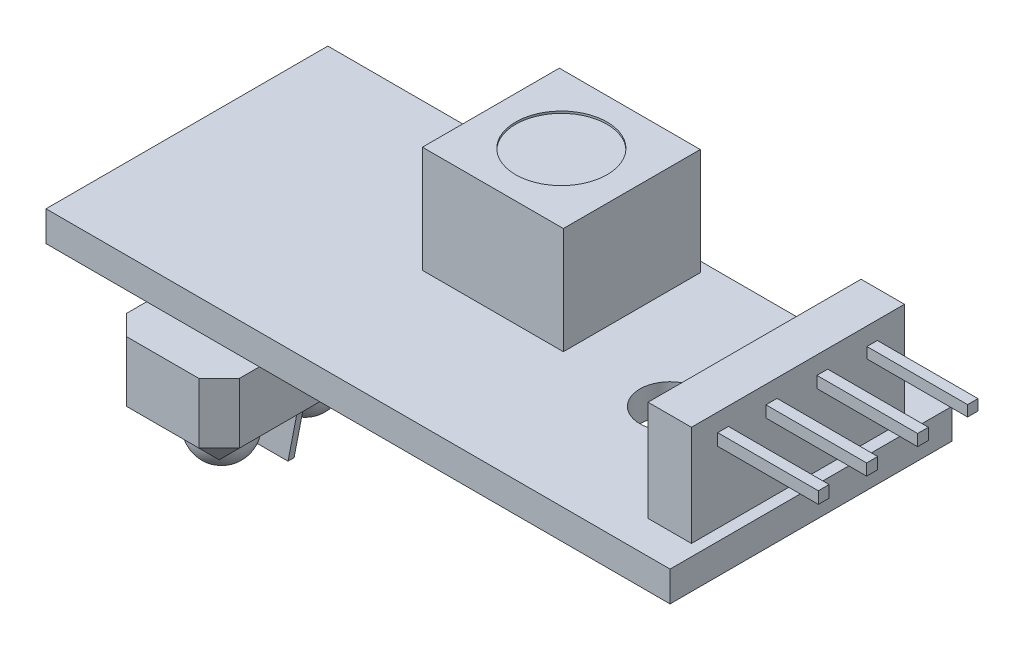
from build123d import *
from OCP.BRepFilletAPI import BRepFilletAPI_MakeChamfer

# Parameters (mm, degrees)
SKETCH_1_W          = 31
SKETCH_1_H          = 14
EXTRUDE_1_DEPTH     = 1.5
SKETCH_2_W          = 7
SKETCH_2_H          = 6.8
EXTRUDE_2_DEPTH     = 5.3
SKETCH_3_W          = 2.154803144
SKETCH_3_H          = 10.581622582
EXTRUDE_3_DEPTH     = 5
SKETCH_5_W          = 0.534399799
SKETCH_5_H          = 0.586115909
EXTRUDE_4_DEPTH     = 5
SKETCH_5_W_2        = 0.551638502
SKETCH_5_H_2        = 0.568877205
EXTRUDE_4_2_DEPTH   = 5
EXTRUDE_4_3_DEPTH   = 5
SKETCH_5_W_3        = 0.517161096
SKETCH_5_H_3        = 0.534399799
EXTRUDE_4_4_DEPTH   = 5
EXTRUDE_START       = 4
SKETCH_6_W          = 5.6
SKETCH_6_H          = 10
EXTRUDE_5_DEPTH     = 4
EXTRUDE_6_REACH     = 38.99
SKETCH_7_W          = 0.6
SKETCH_7_H          = 0.6
CHAMFER_1_SIZE      = 1
SKETCH_8_R          = 1.5
CUT_EXTRUDE_1_DEPTH = 3
SKETCH_9_W          = 3.6
SKETCH_9_H          = 0.3
EXTRUDE_7_DEPTH     = 2.2
CHAMFER_2_SIZE      = 2.2
CHAMFER_2_SIZE_2    = 0.42763668
SKETCH_12_R         = 2.270300466
CUT_EXTRUDE_2_DEPTH = 0.1


with BuildPart() as part:
    # 草圖1 → 填料-伸長1 (new body)
    with BuildSketch(Plane(origin=(0, 0, 0), x_dir=(1, 0, 0), z_dir=(0, 1, 0))):
        with Locations((15.5, 0)):
            Rectangle(SKETCH_1_W, SKETCH_1_H)
    extrude(amount=EXTRUDE_1_DEPTH)

    # 草圖8 → 除料-伸長1 (cut)
    with BuildSketch(Plane(origin=(0, 1.5, 0), x_dir=(1, 0, 0), z_dir=(0, 1, 0))):
        with Locations(Location((24, 0, 0), (0, 0, 270))):
            Circle(SKETCH_8_R)
    extrude(amount=-CUT_EXTRUDE_1_DEPTH, mode=Mode.SUBTRACT)


with BuildPart() as body_2:
    # 草圖2 → 填料-伸長2 (new body)
    with BuildSketch(Plane(origin=(0, 1.5, 0), x_dir=(1, 0, 0), z_dir=(0, 1, 0))):
        with Locations((15.5, 3.1)):
            Rectangle(SKETCH_2_W, SKETCH_2_H)
    extrude(amount=EXTRUDE_2_DEPTH)

    # 草圖12 → 除料-伸長2 (cut)
    with BuildSketch(Plane(origin=(0, 6.8, 0), x_dir=(1, 0, 0), z_dir=(0, 1, 0))):
        with Locations(Location((15.5, 3.1, 0), (0, 0, 270))):
            Circle(SKETCH_12_R)
    extrude(amount=-CUT_EXTRUDE_2_DEPTH, mode=Mode.SUBTRACT)


with BuildPart() as body_3:
    # 草圖3 → 填料-伸長3 (new body)
    with BuildSketch(Plane(origin=(0, 1.5, 0), x_dir=(1, 0, 0), z_dir=(0, 1, 0))):
        with Locations((29.352305926, -0.076957255)):
            Rectangle(SKETCH_3_W, SKETCH_3_H)
    extrude(amount=EXTRUDE_3_DEPTH)


with BuildPart() as body_4:
    # 草圖5 → 填料-伸長4 (new body)
    with BuildSketch(Plane(origin=(30.429707498, 0, 0), x_dir=(0, 0, -1), z_dir=(1, 0, 0))):
        with Locations((-3.795796662, 5.3218671)):
            Rectangle(SKETCH_5_W, SKETCH_5_H)
    extrude(amount=EXTRUDE_4_DEPTH)


with BuildPart() as body_5:
    # 草圖5 → Extrude 4 2 (new body)
    with BuildSketch(Plane(origin=(30.429707498, 0, 0), x_dir=(0, 0, -1), z_dir=(1, 0, 0))):
        with Locations((-1.390997567, 5.330486452)):
            Rectangle(SKETCH_5_W_2, SKETCH_5_H_2)
    extrude(amount=EXTRUDE_4_2_DEPTH)


with BuildPart() as body_6:
    # 草圖5 → Extrude 4 3 (new body)
    with BuildSketch(Plane(origin=(30.429707498, 0, 0), x_dir=(0, 0, -1), z_dir=(1, 0, 0))):
        with Locations((1.134472451, 5.330486452)):
            Rectangle(SKETCH_5_W, SKETCH_5_H_2)
    extrude(amount=EXTRUDE_4_3_DEPTH)


with BuildPart() as body_7:
    # 草圖5 → Extrude 4 4 (new body)
    with BuildSketch(Plane(origin=(30.429707498, 0, 0), x_dir=(0, 0, -1), z_dir=(1, 0, 0))):
        with Locations((3.608226359, 5.347725155)):
            Rectangle(SKETCH_5_W_3, SKETCH_5_H_3)
    extrude(amount=EXTRUDE_4_4_DEPTH)


with BuildPart() as body_8:
    # 草圖6 → 填料-伸長5 (new body)
    with BuildSketch(Plane.XZ.offset(EXTRUDE_START)):
        with Locations((3.8, 0)):
            Rectangle(SKETCH_6_W, SKETCH_6_H)
    extrude(amount=EXTRUDE_5_DEPTH)


with BuildPart() as body_9:

    # 草圖7 → 填料-伸長6 (new, up to next)
    with BuildSketch(Plane.XZ, mode=Mode.PRIVATE) as extrude_6_sk1:
        with Locations((2.464305344, 2.563535255)):
            Rectangle(SKETCH_7_W, SKETCH_7_H)
    extrude_6_tool1 = extrude(extrude_6_sk1.sketch, amount=EXTRUDE_6_REACH, mode=Mode.PRIVATE) - body_8.part
    # 草圖7 → 填料-伸長6 (new, up to next)
    with BuildSketch(Plane.XZ, mode=Mode.PRIVATE) as extrude_6_sk2:
        with Locations((5.096791463, 2.604991729)):
            Rectangle(SKETCH_7_W, SKETCH_7_H)
    extrude_6_tool2 = extrude(extrude_6_sk2.sketch, amount=EXTRUDE_6_REACH, mode=Mode.PRIVATE) - body_8.part
    # 草圖7 → 填料-伸長6 (new, up to next)
    with BuildSketch(Plane.XZ, mode=Mode.PRIVATE) as extrude_6_sk3:
        with Locations((2.588674767, -2.452698138)):
            Rectangle(SKETCH_7_W, SKETCH_7_H)
    extrude_6_tool3 = extrude(extrude_6_sk3.sketch, amount=EXTRUDE_6_REACH, mode=Mode.PRIVATE) - body_8.part
    # 草圖7 → 填料-伸長6 (new, up to next)
    with BuildSketch(Plane.XZ, mode=Mode.PRIVATE) as extrude_6_sk4:
        with Locations((5.1175197, -2.411241663)):
            Rectangle(SKETCH_7_W, SKETCH_7_H)
    extrude_6_tool4 = extrude(extrude_6_sk4.sketch, amount=EXTRUDE_6_REACH, mode=Mode.PRIVATE) - body_8.part
    add(extrude_6_tool1.solids().sort_by_distance((2.464305, 0, 2.563535))[0])
    add(extrude_6_tool2.solids().sort_by_distance((5.096791, 0, 2.604992))[0])
    add(extrude_6_tool3.solids().sort_by_distance((2.588675, 0, -2.452698))[0])
    add(extrude_6_tool4.solids().sort_by_distance((5.11752, 0, -2.411242))[0])


with BuildPart() as body_8_1:
    add(body_8.part)

    # 導角1
    chamfer_1_edges = [body_8_1.edges().sort_by_distance(p)[0] for p in [
        (6.6, -8, 0),
        (3.8, -8, 5),
        (1, -8, 0),
        (3.8, -8, -5),
        (1, -6, 5),
        (6.6, -6, 5),
    ]]
    chamfer(chamfer_1_edges, length=CHAMFER_1_SIZE)

    # 草圖9 → 填料-伸長7 (add)
    with BuildSketch(Plane.XZ.offset(8)):
        with Locations((3.8, 0)):
            Rectangle(SKETCH_9_W, SKETCH_9_H)
    extrude(amount=EXTRUDE_7_DEPTH)

    # 導角2
    chamfer_2_edges_1 = [body_8_1.edges().sort_by_distance(p)[0] for p in [
        (5.6, -10.2, 0),
    ]]
    chamfer_2_side_1 = [body_8_1.faces().sort_by_distance(p)[0] for p in [
        (5.6, -10.191447266, 0),
    ]]
    chamfer_2_edges_2 = [body_8_1.edges().sort_by_distance(p)[0] for p in [
        (2, -10.2, 0),
    ]]
    chamfer_2_side_2 = [body_8_1.faces().sort_by_distance(p)[0] for p in [
        (2, -10.191447266, 0),
    ]]
    chamfer_2 = BRepFilletAPI_MakeChamfer(body_8_1.part.solid().wrapped)
    for e in chamfer_2_edges_1:
        chamfer_2.Add(CHAMFER_2_SIZE - 0.0001, CHAMFER_2_SIZE_2 - 0.0001, e.wrapped, chamfer_2_side_1[0].wrapped)
    for e in chamfer_2_edges_2:
        chamfer_2.Add(CHAMFER_2_SIZE - 0.0001, CHAMFER_2_SIZE_2 - 0.0001, e.wrapped, chamfer_2_side_2[0].wrapped)
    add(Compound.cast(chamfer_2.Shape()), mode=Mode.REPLACE)  # a hair under: the kernel refuses the full size

    # 草圖11 → 旋轉2 (revolve)
    with BuildSketch(Plane.ZY.offset(-3.8)):
        with BuildLine():
            Line((2.075, -8), (2.075, -9.8))
            ThreePointArc((2.075, -9.8), (3.064949494, -9.389949494), (3.475, -8.4))
            Line((3.475, -8.4), (3.475, -8))
            Line((3.475, -8), (2.075, -8))
        make_face()
    revolve(axis=Axis((3.8, -8, 2.075), (0, -1, 0)))


with BuildPart() as body_10:
    # 草圖10 → 旋轉1 (revolve)
    with BuildSketch(Plane.ZY.offset(-3.8)):
        with BuildLine():
            Line((-2.075, -8), (-2.075, -9.8))
            ThreePointArc((-2.075, -9.8), (-3.064949494, -9.389949494), (-3.475, -8.4))
            Line((-3.475, -8.4), (-3.475, -8))
            Line((-3.475, -8), (-2.075, -8))
        make_face()
    revolve(axis=Axis((3.8, -8, -2.075), (0, -1, 0)))


solid = Compound([part.part, body_2.part, body_3.part, body_4.part, body_5.part, body_6.part, body_7.part, body_9.part, body_8_1.part, body_10.part])
